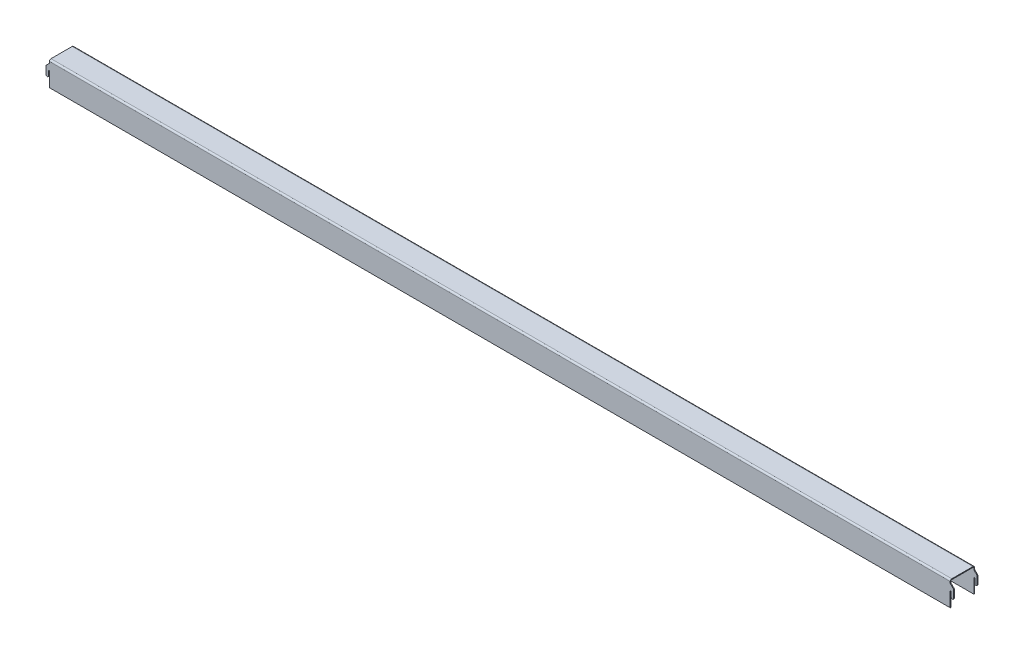
from build123d import *

# Parameters (mm, degrees)
SKETCH2_W                    = 2347.722
SKETCH2_H                    = 63.5
BASE_FLANGE1_DEPTH           = 2.0574
EDGE_FLANGE1_STRIP_W         = 12.2936
EDGE_FLANGE1_STRIP_H         = 2.0574
EDGE_FLANGE1_STRIP_CUT_DEPTH = 2347.722
EDGE_FLANGE1_DEPTH           = 2347.722
EDGE_FLANGE1_FLAT_DEPTH      = 2.0574


# Sheet-metal steps are written as plain solids
with BuildPart() as part:
    # Sketch2 → Base-Flange1 (new body)
    with BuildSketch(Plane(origin=(0, 0, 0), x_dir=(1, 0, 0), z_dir=(0, 1, 0))):
        Rectangle(SKETCH2_W, SKETCH2_H)
    extrude(amount=-BASE_FLANGE1_DEPTH)

    # Edge-Flange1 strip (across the edge) → Edge-Flange1 strip cut (cut)
    with BuildSketch(Plane(origin=(-1173.861, -2.0574, -31.75), x_dir=(0, 0, 1), z_dir=(1, 0, 0))):
        with Locations((-2.0574, -1.0287)):
            Rectangle(EDGE_FLANGE1_STRIP_W, EDGE_FLANGE1_STRIP_H)
    edge_flange1_strip_cut = extrude(amount=EDGE_FLANGE1_STRIP_CUT_DEPTH, mode=Mode.SUBTRACT)

    # Edge-Flange1 bend section (across the edge) → Edge-Flange1 (add)
    with BuildSketch(Plane(origin=(-1173.861, -2.0574, -31.75), x_dir=(0, 0, 1), z_dir=(1, 0, 0))):
        with BuildLine():
            Line((0, 2.032), (2.0574, 2.032))
            ThreePointArc((2.0574, 2.032), (2.652559021, 0.595159021), (4.0894, 0))
            Line((4.0894, 0), (4.0894, -2.0574))
            ThreePointArc((4.0894, -2.0574), (1.197757529, -0.859642471), (0, 2.032))
        make_face()
    edge_flange1 = extrude(amount=EDGE_FLANGE1_DEPTH)

    # Edge-Flange1 profile (on flange) → Edge-Flange1 flat (add)
    with BuildSketch(Plane(origin=(0, -2.0574, -31.75), x_dir=(-1, 0, 0), z_dir=(0, 0, 1))):
        with BuildLine():
            Line((1176.401, 36.0426), (1176.401, 23.3426))
            Line((1176.401, 23.3426), (1173.861, 23.3426))
            Line((1173.861, 23.3426), (1173.861, 61.4426))
            Line((1173.861, 61.4426), (-1173.861, 61.4426))
            Line((-1173.861, 61.4426), (-1173.861, 23.3426))
            Line((-1173.861, 23.3426), (-1176.401, 23.3426))
            Line((-1176.401, 23.3426), (-1176.401, 36.0426))
            ThreePointArc((-1176.401, 36.0426), (-1179.576, 39.2176), (-1182.751, 36.0426))
            Line((-1182.751, 36.0426), (-1182.751, 15.24))
            Line((-1182.751, 15.24), (-1173.861, 6.35))
            Line((-1173.861, 6.35), (-1173.861, 2.032))
            Line((-1173.861, 2.032), (1173.861, 2.032))
            Line((1173.861, 2.032), (1173.861, 6.35))
            Line((1173.861, 6.35), (1182.751, 15.24))
            Line((1182.751, 15.24), (1182.751, 36.0426))
            ThreePointArc((1182.751, 36.0426), (1179.576, 39.2176), (1176.401, 36.0426))
        make_face()
    edge_flange1_flat = extrude(amount=EDGE_FLANGE1_FLAT_DEPTH)

    # Mirror1: Edge-Flange1 strip cut, Edge-Flange1, Edge-Flange1 flat across plane
    add(edge_flange1_strip_cut.mirror(Plane.XY), mode=Mode.SUBTRACT)
    add(edge_flange1.mirror(Plane.XY))
    add(edge_flange1_flat.mirror(Plane.XY))


solid = part.part
